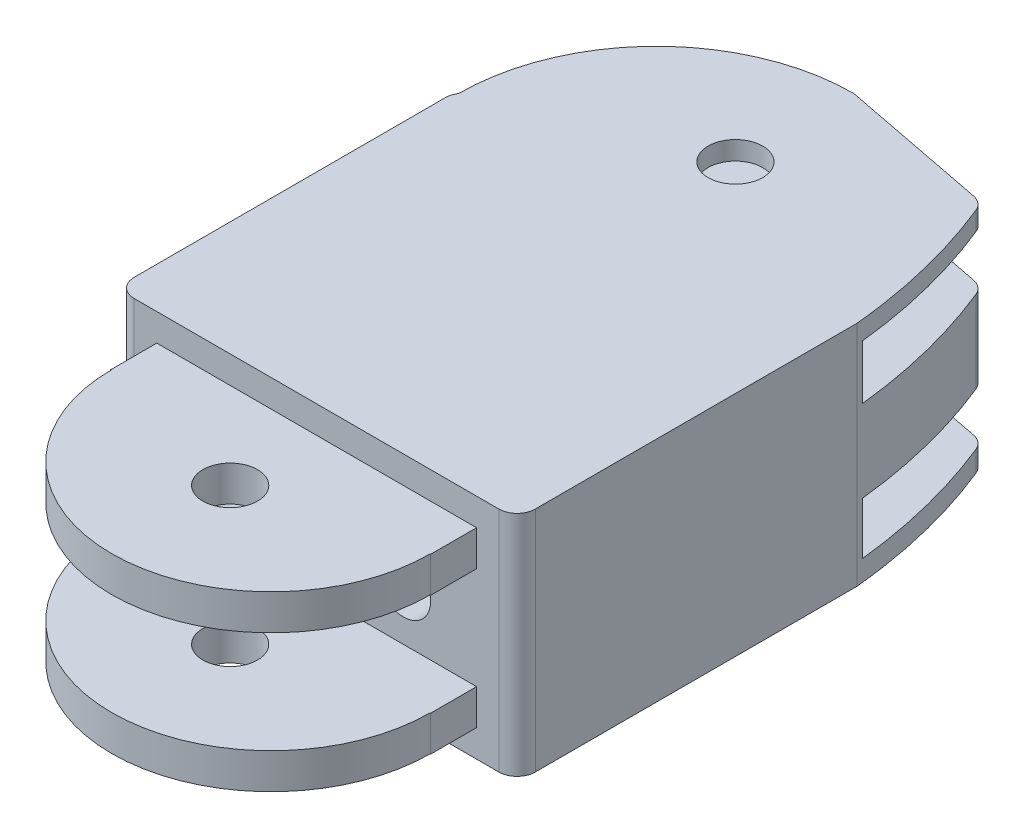
from build123d import *

# Parameters (mm, degrees)
SKETCH2_W               = 17.554431489
SKETCH2_H               = 1.95
BOSS_EXTRUDE1_DEPTH     = 8.75
BOSS_EXTRUDE1_2_DEPTH   = 8.75
CUT_EXTRUDE1_DEPTH      = 26.518349076
SKETCH4_W               = 22.027215745
SKETCH4_H               = 12.505427167
BOSS_EXTRUDE2_DEPTH     = 32
SKETCH5_R               = 1.5
CUT_EXTRUDE2_DEPTH      = 12
SKETCH6_W               = 22.027215745
SKETCH6_H               = 12.505427167
SKETCH6_W_2             = 17.554431489
SKETCH6_H_2             = 1.95
CUT_EXTRUDE3_DEPTH      = 2.5
SKETCH7_R               = 1.5
CUT_EXTRUDE4_DEPTH      = 13
CUT_EXTRUDE5_DEPTH      = 10
CUT_EXTRUDE5_DEPTH_BACK = 32
SKETCH8_R               = 1.5
FILLET3_R               = 1
SKETCH9_W               = 22.034876082
SKETCH9_H               = 2.976325088
SKETCH9_H_2             = 2.861616895
CUT_EXTRUDE6_DEPTH      = 11
SKETCH10_W              = 17.922244656
SKETCH10_H              = 2.976325088
SKETCH10_H_2            = 2.861616895
CUT_EXTRUDE7_DEPTH      = 5


with BuildPart() as part:
    # Sketch2 → Boss-Extrude1 (new body)
    with BuildSketch(Plane.XY):
        with Locations((-13.228930986, -27.845183414)):
            Rectangle(SKETCH2_W, SKETCH2_H)
    extrude(amount=BOSS_EXTRUDE1_DEPTH)


with BuildPart() as body_2:
    # Sketch2 → Boss-Extrude1 2 (new body)
    with BuildSketch(Plane.XY):
        with Locations((-13.228930986, -20.289756247)):
            Rectangle(SKETCH2_W, SKETCH2_H)
    extrude(amount=BOSS_EXTRUDE1_2_DEPTH)


with BuildPart() as cut_extrude1_tool:
    # Sketch3 → Cut-Extrude1 (new, through all)
    with BuildSketch(Plane(origin=(0, -19.314756247, 0), x_dir=(1, 0, 0), z_dir=(0, 1, 0))):
        with BuildLine():
            ThreePointArc((-13.228930986, -8.75), (-7.041746651, -6.187184335), (-4.478930986, 0))
            add(Edge.make_bspline(
                [(-4.478930986, 0), (1.138349918, -4.151657709), (-4.451715242, -8.75)],
                knots=[0, 0, 0, 1, 1, 1], degree=2))
            add(Edge.make_bspline(
                [(-22.006146731, -8.75), (-13.228930986, -12.473510392), (-4.451715242, -8.75)],
                knots=[0, 0, 0, 1, 1, 1], degree=2))
            add(Edge.make_bspline(
                [(-21.978930986, 0), (-25.926969228, -4.242865138), (-22.006146731, -8.75)],
                knots=[0, 0, 0, 1, 1, 1], degree=2))
            ThreePointArc((-21.978930986, 0), (-19.416115322, -6.187184335), (-13.228930986, -8.75))
        make_face()
    extrude(amount=-CUT_EXTRUDE1_DEPTH)


with BuildPart() as part_1:
    add(part.part)

    # Cut-Extrude1: cut by cut_extrude1_tool
    add(cut_extrude1_tool.part, mode=Mode.SUBTRACT)



with BuildPart() as body_2_1:
    add(body_2.part)

    # Cut-Extrude1: cut by cut_extrude1_tool
    add(cut_extrude1_tool.part, mode=Mode.SUBTRACT)


with BuildPart() as part_2:
    add(part_1.part)

    add(body_2_1.part)  # Boss-Extrude2 merges body 2
    # Sketch4 → Boss-Extrude2 (add)
    with BuildSketch(Plane(origin=(0, 0, 0), x_dir=(-1, 0, 0), z_dir=(0, 0, -1))):
        with Locations((13.242538859, -24.067469831)):
            Rectangle(SKETCH4_W, SKETCH4_H)
    extrude(amount=BOSS_EXTRUDE2_DEPTH)

    # Sketch5 → Cut-Extrude2 (cut)
    with BuildSketch(Plane(origin=(0, -19.314756247, 0), x_dir=(1, 0, 0), z_dir=(0, 1, 0))):
        with Locations(Location((-13.228930986, -2.25, 0), (0, 0, 270))):
            Circle(SKETCH5_R)
    extrude(amount=-CUT_EXTRUDE2_DEPTH, mode=Mode.SUBTRACT)

    # Sketch6 → Cut-Extrude3 (cut)
    with BuildSketch(Plane.XY):
        with Locations((-13.242538859, -24.067469831)):
            Rectangle(SKETCH6_W, SKETCH6_H)
        with Locations((-13.228930986, -27.845183414)):
            Rectangle(SKETCH6_W_2, SKETCH6_H_2, mode=Mode.SUBTRACT)
        with Locations((-13.228930986, -20.289756247)):
            Rectangle(SKETCH6_W_2, SKETCH6_H_2, mode=Mode.SUBTRACT)
    extrude(amount=-CUT_EXTRUDE3_DEPTH, mode=Mode.SUBTRACT)

    # Sketch7 → Cut-Extrude4 (cut)
    with BuildSketch(Plane(origin=(0, -17.814756247, 0), x_dir=(1, 0, 0), z_dir=(0, 1, 0))):
        with Locations(Location((-13.242538859, 25.5, 0), (0, 0, 270))):
            Circle(SKETCH7_R)
        with BuildLine():
            Line((-24.086865874, 21.155672985), (-24.256146731, 21.155672985))
            add(Edge.make_bspline(
                [(-2.228930986, 21.155672985), (11.471530889, 27.189710441), (-11.765166974, 53.431279988), (-37.007876173, 21.523583672), (-24.256146731, 21.155672985)],
                knots=[0, 0, 0, 0, 0.52011282, 1, 1, 1, 1], degree=3))
            add(Edge.make_bspline(
                [(-4.552660132, 30.311399113), (-2.685211009, 25.928521854), (-2.228930986, 21.155672985)],
                knots=[0, 0, 0, 1, 1, 1], degree=2))
            Line((-4.552660132, 30.311399113), (-13.242538859, 32))
            ThreePointArc((-13.242538859, 32), (-20.910636028, 28.823770155), (-24.086865874, 21.155672985))
        make_face()
    extrude(amount=-CUT_EXTRUDE4_DEPTH, mode=Mode.SUBTRACT)

    # Sketch8 → Cut-Extrude5 (cut, two sides: drawn at the far end of the back side and taken through both)
    with BuildSketch(Plane.XY.offset(-2.5).offset(-CUT_EXTRUDE5_DEPTH_BACK)):
        with Locations(Location((-18.011106811, -24.06746983, 0), (0, 0, 180))):
            Circle(SKETCH8_R)
        with Locations(Location((-8.473970906, -24.06746983, 0), (0, 0, 180))):
            Circle(SKETCH8_R)
    extrude(amount=CUT_EXTRUDE5_DEPTH + CUT_EXTRUDE5_DEPTH_BACK, mode=Mode.SUBTRACT)

    # Fillet3
    # the kernel refuses this fillet: 1 mm, written as the material it takes off along each edge
    with BuildSketch(Plane(origin=(-24.256146731, -15.314756247, -2.5), x_dir=(0, 0, -1), z_dir=(0, -1, 0)), Plane(origin=(-2.228930986, -32.820183414, -2.5), x_dir=(0, 0, -1), z_dir=(0, 1, 0))) as fillet3_piece_1:
        with BuildLine():
            CenterArc((FILLET3_R, FILLET3_R), FILLET3_R, 180, 90)
            Line((0, FILLET3_R), (-FILLET3_R * 0.02, FILLET3_R))
            Line((-FILLET3_R * 0.02, FILLET3_R), (-FILLET3_R * 0.02, -FILLET3_R * 0.02))
            Line((-FILLET3_R * 0.02, -FILLET3_R * 0.02), (FILLET3_R, -FILLET3_R * 0.02))
            Line((FILLET3_R, -FILLET3_R * 0.02), (FILLET3_R, 0))
        make_face()
    extrude(amount=17.505427167, mode=Mode.SUBTRACT)
    with BuildSketch(Plane(origin=(-24.256146731, -16.423026869, -21.155672985), x_dir=(1.0, 0, 2.5394386720559264e-12), z_dir=(0, -1, 0))) as fillet3_piece_2:
        with BuildLine():
            CenterArc((1, 0.556691751), FILLET3_R, 180, 33.827317624)
            Line((0, 0.556691751), (-0.02, 0.556691751))
            Line((-0.02, 0.556691751), (-0.02, 0))
            Line((-0.02, 0), (0, -0.02))
            ThreePointArc((0, -0.02), (0.084640429, -0.02), (0.152666474, -0.011133835))
            Line((0.152666474, -0.011133835), (0.169280857, 0))
        make_face()
    extrude(amount=15.288885922, mode=Mode.SUBTRACT)
    with BuildSketch(Plane(origin=(-4.552660132, -16.451585564, -30.311399113), x_dir=(0.3839298520349852, 0, 0.9233622629912891), z_dir=(0, -1, 0))) as fillet3_piece_3:
        with BuildLine():
            CenterArc((0.536514164, 0.999961682), FILLET3_R, 213.573886674, 56.927693277)
            Line((-0.296659206, 0.446949805), (-0.313322674, 0.435889568))
            Line((-0.313322674, 0.435889568), (-0.016663467, -0.011060238))
            Line((-0.016663467, -0.011060238), (-0.0001747, -0.019999237))
            ThreePointArc((-0.0001747, -0.019999237), (0.272634035, -0.021192075), (0.545443356, -0.019999234))
            Line((0.545443356, -0.019999234), (0.545268273, 0))
        make_face()
    extrude(amount=15.231768533, mode=Mode.SUBTRACT)

    # Sketch9 → Cut-Extrude6 (cut)
    with BuildSketch(Plane.XY.offset(-32.5)):
        with Locations((-13.229542087, -20.326593706)):
            Rectangle(SKETCH9_W, SKETCH9_H)
        with Locations((-13.229542087, -27.750991873)):
            Rectangle(SKETCH9_W, SKETCH9_H_2)
    extrude(amount=CUT_EXTRUDE6_DEPTH, mode=Mode.SUBTRACT)

    # Sketch10 → Cut-Extrude7 (cut)
    with BuildSketch(Plane(origin=(0, 0, -21.5), x_dir=(-1, 0, 0), z_dir=(0, 0, -1))):
        with Locations((12.848616278, -20.326593706)):
            Rectangle(SKETCH10_W, SKETCH10_H)
        with Locations((12.848616278, -27.750991873)):
            Rectangle(SKETCH10_W, SKETCH10_H_2)
    extrude(amount=-CUT_EXTRUDE7_DEPTH, mode=Mode.SUBTRACT)


solid = part_2.part
